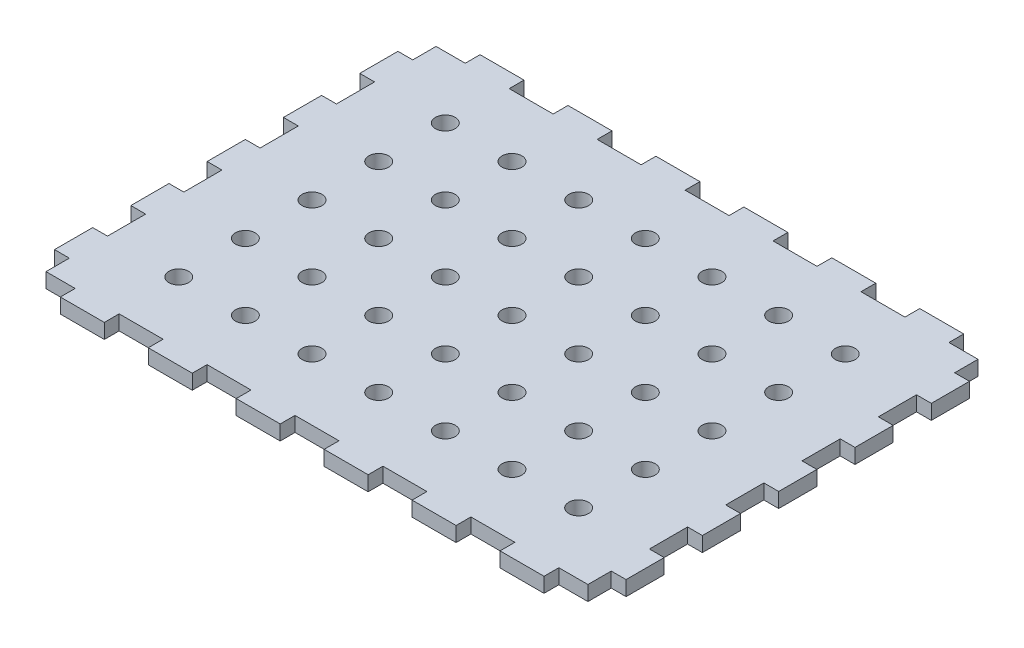
from build123d import *

# Parameters (mm, degrees)
ESBO_O1_W                = 231.5
ESBO_O1_H                = 170
ESBO_O1_R                = 4
RESSALTO_EXTRUS_O1_DEPTH = 6
ESBO_O6_W                = 17.807692308
ESBO_O6_H                = 6
ESBO_O6_W_2              = 17.78
CORTE_EXTRUS_O1_DEPTH    = 6
CORTE_EXTRUS_O2_REACH    = 145.733
ESBO_O7_W                = 6
ESBO_O7_H                = 15.454545455


with BuildPart() as part:
    # Esboço1 → Ressalto-extrusão1 (new body)
    with BuildSketch(Plane(origin=(0, 0, 0), x_dir=(1, 0, 0), z_dir=(0, 1, 0))):
        Rectangle(ESBO_O1_W, ESBO_O1_H)
        with Locations((0, 54)):
            Circle(ESBO_O1_R, mode=Mode.SUBTRACT)
        with Locations((27, 54)):
            Circle(ESBO_O1_R, mode=Mode.SUBTRACT)
        with Locations((54, 54)):
            Circle(ESBO_O1_R, mode=Mode.SUBTRACT)
        with Locations((81, 54)):
            Circle(ESBO_O1_R, mode=Mode.SUBTRACT)
        with Locations((-81, -54)):
            Circle(ESBO_O1_R, mode=Mode.SUBTRACT)
        with Locations((-54, -54)):
            Circle(ESBO_O1_R, mode=Mode.SUBTRACT)
        with Locations((-27, -54)):
            Circle(ESBO_O1_R, mode=Mode.SUBTRACT)
        with Locations((-81, -27)):
            Circle(ESBO_O1_R, mode=Mode.SUBTRACT)
        with Locations((-54, -27)):
            Circle(ESBO_O1_R, mode=Mode.SUBTRACT)
        with Locations((-27, -27)):
            Circle(ESBO_O1_R, mode=Mode.SUBTRACT)
        with Locations((0, -54)):
            Circle(ESBO_O1_R, mode=Mode.SUBTRACT)
        with Locations((27, -54)):
            Circle(ESBO_O1_R, mode=Mode.SUBTRACT)
        with Locations((54, -54)):
            Circle(ESBO_O1_R, mode=Mode.SUBTRACT)
        with Locations((81, -54)):
            Circle(ESBO_O1_R, mode=Mode.SUBTRACT)
        with Locations((0, -27)):
            Circle(ESBO_O1_R, mode=Mode.SUBTRACT)
        with Locations((27, -27)):
            Circle(ESBO_O1_R, mode=Mode.SUBTRACT)
        with Locations((54, -27)):
            Circle(ESBO_O1_R, mode=Mode.SUBTRACT)
        with Locations((81, -27)):
            Circle(ESBO_O1_R, mode=Mode.SUBTRACT)
        with Locations((-81, 0)):
            Circle(ESBO_O1_R, mode=Mode.SUBTRACT)
        with Locations((-81, 27)):
            Circle(ESBO_O1_R, mode=Mode.SUBTRACT)
        with Locations((-54, 0)):
            Circle(ESBO_O1_R, mode=Mode.SUBTRACT)
        with Locations((-27, 0)):
            Circle(ESBO_O1_R, mode=Mode.SUBTRACT)
        with Locations((-54, 27)):
            Circle(ESBO_O1_R, mode=Mode.SUBTRACT)
        with Locations((-27, 27)):
            Circle(ESBO_O1_R, mode=Mode.SUBTRACT)
        with Locations((-81, 54)):
            Circle(ESBO_O1_R, mode=Mode.SUBTRACT)
        with Locations((-54, 54)):
            Circle(ESBO_O1_R, mode=Mode.SUBTRACT)
        with Locations((-27, 54)):
            Circle(ESBO_O1_R, mode=Mode.SUBTRACT)
        Circle(ESBO_O1_R, mode=Mode.SUBTRACT)
        with Locations((27, 0)):
            Circle(ESBO_O1_R, mode=Mode.SUBTRACT)
        with Locations((54, 0)):
            Circle(ESBO_O1_R, mode=Mode.SUBTRACT)
        with Locations((0, 27)):
            Circle(ESBO_O1_R, mode=Mode.SUBTRACT)
        with Locations((27, 27)):
            Circle(ESBO_O1_R, mode=Mode.SUBTRACT)
        with Locations((54, 27)):
            Circle(ESBO_O1_R, mode=Mode.SUBTRACT)
        with Locations((81, 0)):
            Circle(ESBO_O1_R, mode=Mode.SUBTRACT)
        with Locations((81, 27)):
            Circle(ESBO_O1_R, mode=Mode.SUBTRACT)
    extrude(amount=RESSALTO_EXTRUS_O1_DEPTH)

    # Esboço6 → Corte-extrusão1 (cut)
    with BuildSketch(Plane.XZ):
        with Locations((-106.846153846, 82)):
            Rectangle(ESBO_O6_W, ESBO_O6_H)
        with Locations((-71.226153846, 82)):
            Rectangle(ESBO_O6_W, ESBO_O6_H)
        with Locations((-106.846153846, -82)):
            Rectangle(ESBO_O6_W, ESBO_O6_H)
        with Locations((-35.606153846, 82)):
            Rectangle(ESBO_O6_W, ESBO_O6_H)
        with Locations((-71.226153846, -82)):
            Rectangle(ESBO_O6_W, ESBO_O6_H)
        with Locations((0.013846154, 82)):
            Rectangle(ESBO_O6_W, ESBO_O6_H)
        with Locations((-35.606153846, -82)):
            Rectangle(ESBO_O6_W, ESBO_O6_H)
        with Locations((35.633846154, 82)):
            Rectangle(ESBO_O6_W, ESBO_O6_H)
        with Locations((0.013846154, -82)):
            Rectangle(ESBO_O6_W, ESBO_O6_H)
        with Locations((71.253846154, 82)):
            Rectangle(ESBO_O6_W, ESBO_O6_H)
        with Locations((35.633846154, -82)):
            Rectangle(ESBO_O6_W, ESBO_O6_H)
        with Locations((106.86, 82)):
            Rectangle(ESBO_O6_W_2, ESBO_O6_H)
        with Locations((71.253846154, -82)):
            Rectangle(ESBO_O6_W, ESBO_O6_H)
        with Locations((106.86, -82)):
            Rectangle(ESBO_O6_W_2, ESBO_O6_H)
    extrude(amount=-CORTE_EXTRUS_O1_DEPTH, mode=Mode.SUBTRACT)

    # Esboço7 → Corte-extrusão2 (cut, up to next)
    with BuildSketch(Plane.XZ, mode=Mode.PRIVATE) as corte_extrus_o2_sk1:
        with Locations((112.75, -77.272727272)):
            Rectangle(ESBO_O7_W, ESBO_O7_H)
    corte_extrus_o2_tool1 = extrude(corte_extrus_o2_sk1.sketch, amount=-CORTE_EXTRUS_O2_REACH, mode=Mode.PRIVATE) & part.part
    # Esboço7 → Corte-extrusão2 (cut, up to next)
    with BuildSketch(Plane.XZ, mode=Mode.PRIVATE) as corte_extrus_o2_sk2:
        with Locations((-112.75, -77.272727272)):
            Rectangle(ESBO_O7_W, ESBO_O7_H)
    corte_extrus_o2_tool2 = extrude(corte_extrus_o2_sk2.sketch, amount=-CORTE_EXTRUS_O2_REACH, mode=Mode.PRIVATE) & part.part
    # Esboço7 → Corte-extrusão2 (cut, up to next)
    with BuildSketch(Plane.XZ, mode=Mode.PRIVATE) as corte_extrus_o2_sk3:
        with Locations((112.75, -46.362727273)):
            Rectangle(ESBO_O7_W, ESBO_O7_H)
    corte_extrus_o2_tool3 = extrude(corte_extrus_o2_sk3.sketch, amount=-CORTE_EXTRUS_O2_REACH, mode=Mode.PRIVATE) & part.part
    # Esboço7 → Corte-extrusão2 (cut, up to next)
    with BuildSketch(Plane.XZ, mode=Mode.PRIVATE) as corte_extrus_o2_sk4:
        with Locations((112.75, -15.452727273)):
            Rectangle(ESBO_O7_W, ESBO_O7_H)
    corte_extrus_o2_tool4 = extrude(corte_extrus_o2_sk4.sketch, amount=-CORTE_EXTRUS_O2_REACH, mode=Mode.PRIVATE) & part.part
    # Esboço7 → Corte-extrusão2 (cut, up to next)
    with BuildSketch(Plane.XZ, mode=Mode.PRIVATE) as corte_extrus_o2_sk5:
        with Locations((112.75, 15.457272728)):
            Rectangle(ESBO_O7_W, ESBO_O7_H)
    corte_extrus_o2_tool5 = extrude(corte_extrus_o2_sk5.sketch, amount=-CORTE_EXTRUS_O2_REACH, mode=Mode.PRIVATE) & part.part
    # Esboço7 → Corte-extrusão2 (cut, up to next)
    with BuildSketch(Plane.XZ, mode=Mode.PRIVATE) as corte_extrus_o2_sk6:
        with Locations((112.75, 46.367272728)):
            Rectangle(ESBO_O7_W, ESBO_O7_H)
    corte_extrus_o2_tool6 = extrude(corte_extrus_o2_sk6.sketch, amount=-CORTE_EXTRUS_O2_REACH, mode=Mode.PRIVATE) & part.part
    # Esboço7 → Corte-extrusão2 (cut, up to next)
    with BuildSketch(Plane.XZ, mode=Mode.PRIVATE) as corte_extrus_o2_sk7:
        with Locations((112.75, 77.277272728)):
            Rectangle(ESBO_O7_W, ESBO_O7_H)
    corte_extrus_o2_tool7 = extrude(corte_extrus_o2_sk7.sketch, amount=-CORTE_EXTRUS_O2_REACH, mode=Mode.PRIVATE) & part.part
    # Esboço7 → Corte-extrusão2 (cut, up to next)
    with BuildSketch(Plane.XZ, mode=Mode.PRIVATE) as corte_extrus_o2_sk8:
        with Locations((-112.75, -46.362727273)):
            Rectangle(ESBO_O7_W, ESBO_O7_H)
    corte_extrus_o2_tool8 = extrude(corte_extrus_o2_sk8.sketch, amount=-CORTE_EXTRUS_O2_REACH, mode=Mode.PRIVATE) & part.part
    # Esboço7 → Corte-extrusão2 (cut, up to next)
    with BuildSketch(Plane.XZ, mode=Mode.PRIVATE) as corte_extrus_o2_sk9:
        with Locations((-112.75, -15.452727273)):
            Rectangle(ESBO_O7_W, ESBO_O7_H)
    corte_extrus_o2_tool9 = extrude(corte_extrus_o2_sk9.sketch, amount=-CORTE_EXTRUS_O2_REACH, mode=Mode.PRIVATE) & part.part
    # Esboço7 → Corte-extrusão2 (cut, up to next)
    with BuildSketch(Plane.XZ, mode=Mode.PRIVATE) as corte_extrus_o2_sk10:
        with Locations((-112.75, 15.457272728)):
            Rectangle(ESBO_O7_W, ESBO_O7_H)
    corte_extrus_o2_tool10 = extrude(corte_extrus_o2_sk10.sketch, amount=-CORTE_EXTRUS_O2_REACH, mode=Mode.PRIVATE) & part.part
    # Esboço7 → Corte-extrusão2 (cut, up to next)
    with BuildSketch(Plane.XZ, mode=Mode.PRIVATE) as corte_extrus_o2_sk11:
        with Locations((-112.75, 46.367272728)):
            Rectangle(ESBO_O7_W, ESBO_O7_H)
    corte_extrus_o2_tool11 = extrude(corte_extrus_o2_sk11.sketch, amount=-CORTE_EXTRUS_O2_REACH, mode=Mode.PRIVATE) & part.part
    # Esboço7 → Corte-extrusão2 (cut, up to next)
    with BuildSketch(Plane.XZ, mode=Mode.PRIVATE) as corte_extrus_o2_sk12:
        with Locations((-112.75, 77.277272728)):
            Rectangle(ESBO_O7_W, ESBO_O7_H)
    corte_extrus_o2_tool12 = extrude(corte_extrus_o2_sk12.sketch, amount=-CORTE_EXTRUS_O2_REACH, mode=Mode.PRIVATE) & part.part
    add(corte_extrus_o2_tool1.solids().sort_by_distance((112.75, 0, -77.272727))[0], mode=Mode.SUBTRACT)
    add(corte_extrus_o2_tool2.solids().sort_by_distance((-112.75, 0, -77.272727))[0], mode=Mode.SUBTRACT)
    add(corte_extrus_o2_tool3.solids().sort_by_distance((112.75, 0, -46.362727))[0], mode=Mode.SUBTRACT)
    add(corte_extrus_o2_tool4.solids().sort_by_distance((112.75, 0, -15.452727))[0], mode=Mode.SUBTRACT)
    add(corte_extrus_o2_tool5.solids().sort_by_distance((112.75, 0, 15.457273))[0], mode=Mode.SUBTRACT)
    add(corte_extrus_o2_tool6.solids().sort_by_distance((112.75, 0, 46.367273))[0], mode=Mode.SUBTRACT)
    add(corte_extrus_o2_tool7.solids().sort_by_distance((112.75, 0, 77.277273))[0], mode=Mode.SUBTRACT)
    add(corte_extrus_o2_tool8.solids().sort_by_distance((-112.75, 0, -46.362727))[0], mode=Mode.SUBTRACT)
    add(corte_extrus_o2_tool9.solids().sort_by_distance((-112.75, 0, -15.452727))[0], mode=Mode.SUBTRACT)
    add(corte_extrus_o2_tool10.solids().sort_by_distance((-112.75, 0, 15.457273))[0], mode=Mode.SUBTRACT)
    add(corte_extrus_o2_tool11.solids().sort_by_distance((-112.75, 0, 46.367273))[0], mode=Mode.SUBTRACT)
    add(corte_extrus_o2_tool12.solids().sort_by_distance((-112.75, 0, 77.277273))[0], mode=Mode.SUBTRACT)


solid = part.part
